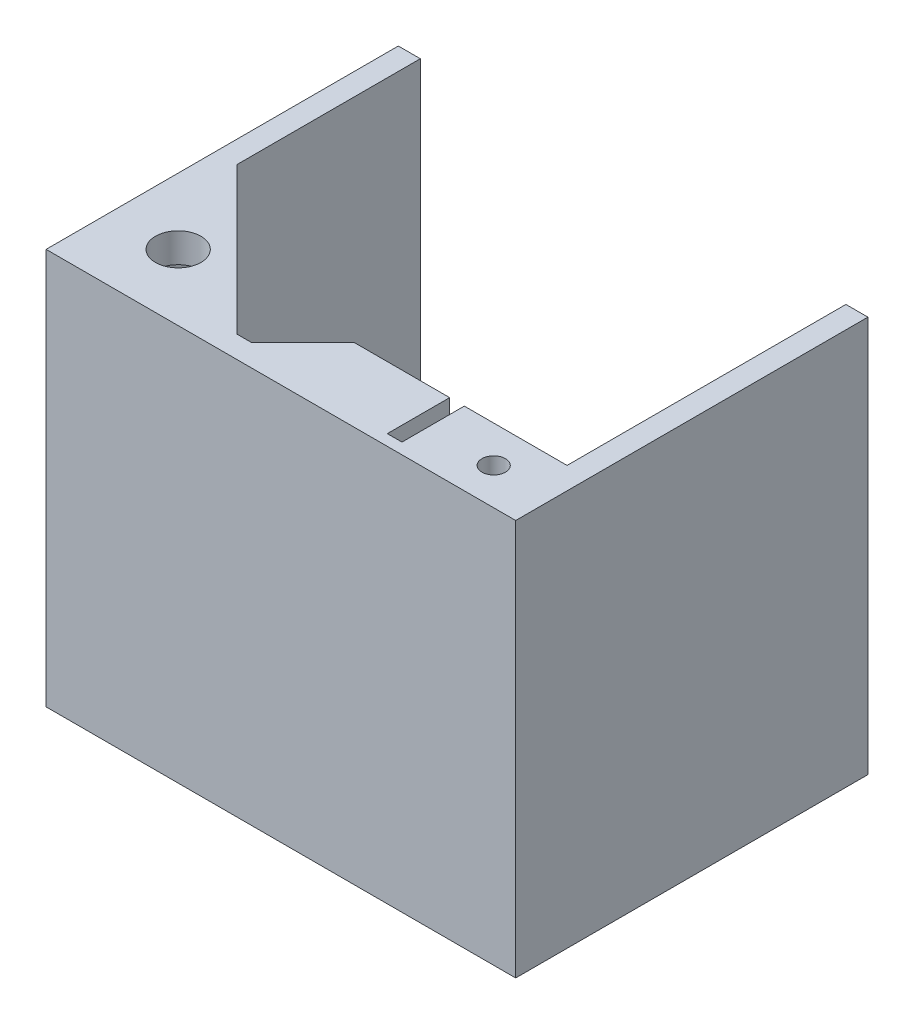
from build123d import *

# Parameters (mm, degrees)
SKETCH1_W           = 64
SKETCH1_H           = 48
BOSS_EXTRUDE1_DEPTH = 4
CUT_EXTRUDE1_DEPTH  = 2.4
CUT_EXTRUDE2_DEPTH  = 2.4
BOSS_EXTRUDE3_DEPTH = 50
BOSS_EXTRUDE4_DEPTH = 50
CUT_EXTRUDE4_DEPTH  = 9.5
SKETCH13_W          = 36.946258726
SKETCH13_H          = 1
CUT_EXTRUDE6_DEPTH  = 32
SKETCH15_R          = 3.1
BOSS_EXTRUDE5_DEPTH = 4
CUT_EXTRUDE7_DEPTH  = 7
SKETCH18_W          = 5.6
SKETCH18_H          = 2.5
CUT_EXTRUDE8_DEPTH  = 5
SKETCH19_W          = 6.595396426
SKETCH19_H          = 7.197552374
SKETCH19_R          = 1.6
BOSS_EXTRUDE8_DEPTH = 4.5
FILLET1_R           = 1.5


with BuildPart() as part:
    # Sketch1 → Boss-Extrude1 (new body)
    with BuildSketch(Plane(origin=(0, 0, 0), x_dir=(1, 0, 0), z_dir=(0, 1, 0))):
        Rectangle(SKETCH1_W, SKETCH1_H)
    extrude(amount=BOSS_EXTRUDE1_DEPTH)

    # Sketch2 → Cut-Extrude1 (cut)
    with BuildSketch(Plane.XZ):
        Polygon((-20.824573519, -16), (-22.41228676, -13.25), (-25.58771324, -13.25), (-27.175426481, -16), (-25.58771324, -18.75), (-22.41228676, -18.75), align=None)
    extrude(amount=-CUT_EXTRUDE1_DEPTH, mode=Mode.SUBTRACT)

    # Sketch4 → Cut-Extrude2 (cut)
    with BuildSketch(Plane.XZ):
        Polygon((9.175426481, 10), (7.58771324, 12.75), (4.41228676, 12.75), (2.824573519, 10), (4.41228676, 7.25), (7.58771324, 7.25), align=None)
    extrude(amount=-CUT_EXTRUDE2_DEPTH, mode=Mode.SUBTRACT)

    # Sketch6 → Boss-Extrude3 (add)
    with BuildSketch(Plane(origin=(0, 4, 0), x_dir=(1, 0, 0), z_dir=(0, 1, 0))):
        Polygon((-29, -21), (-29, 21), (-29, 24), (-32, 24), (-32, -24), (32, -24), (32, 24), (29, 24), (29, 21), (29, -21), align=None)
    extrude(amount=BOSS_EXTRUDE3_DEPTH)

    # Sketch9 → Boss-Extrude4 (add)
    with BuildSketch(Plane(origin=(0, 4, 0), x_dir=(1, 0, 0), z_dir=(0, 1, 0))):
        Polygon((29, -13), (1, -13), (-7, -21), (29, -21), align=None)
    extrude(amount=BOSS_EXTRUDE4_DEPTH)

    # Sketch10 → Cut-Extrude4 (cut)
    with BuildSketch(Plane(origin=(0, 0, 13), x_dir=(-1, 0, 0), z_dir=(0, 0, -1))):
        Polygon((-14.998616503, 39), (-27, 39), (-27, 13), (-1, 13), (-1, 39), (-13.001383497, 39), (-13.001383497, 54), (-14.998616503, 54), align=None)
    extrude(amount=-CUT_EXTRUDE4_DEPTH, mode=Mode.SUBTRACT)

    # Sketch13 → Cut-Extrude6 (cut)
    with BuildSketch(Plane(origin=(0, 54, 0), x_dir=(1, 0, 0), z_dir=(0, 1, 0))):
        with Locations((10.526870637, -13.5)):
            Rectangle(SKETCH13_W, SKETCH13_H)
    extrude(amount=-CUT_EXTRUDE6_DEPTH, mode=Mode.SUBTRACT)

    # Sketch15 → Boss-Extrude5 (add)
    with BuildSketch(Plane(origin=(0, 54, 0), x_dir=(1, 0, 0), z_dir=(0, 1, 0))):
        Polygon((-29, -1), (-9, -21), (-29, -21), align=None)
        with Locations((-23, -15)):
            Circle(SKETCH15_R, mode=Mode.SUBTRACT)
    extrude(amount=-BOSS_EXTRUDE5_DEPTH)

    # Sketch17 → Cut-Extrude7 (cut)
    with BuildSketch(Plane(origin=(0, 54, 0), x_dir=(1, 0, 0), z_dir=(0, 1, 0))):
        Polygon((24, -15.824573519), (21.25, -17.41228676), (21.25, -20.58771324), (24, -22.175426481), (26.75, -20.58771324), (26.75, -17.41228676), align=None)
    extrude(amount=-CUT_EXTRUDE7_DEPTH, mode=Mode.SUBTRACT)

    # Sketch18 → Cut-Extrude8 (cut)
    with BuildSketch(Plane(origin=(0, 0, 14), x_dir=(-1, 0, 0), z_dir=(0, 0, -1))):
        with Locations((-24, 48.25)):
            Rectangle(SKETCH18_W, SKETCH18_H)
    extrude(amount=-CUT_EXTRUDE8_DEPTH, mode=Mode.SUBTRACT)

    # Sketch19 → Boss-Extrude8 (add)
    with BuildSketch(Plane(origin=(0, 54, 0), x_dir=(1, 0, 0), z_dir=(0, 1, 0))):
        with Locations((24, -19)):
            Rectangle(SKETCH19_W, SKETCH19_H)
        with Locations((24, -19)):
            Circle(SKETCH19_R, mode=Mode.SUBTRACT)
    extrude(amount=-BOSS_EXTRUDE8_DEPTH)

    # Fillet1
    fillet1_edges = [part.edges().sort_by_distance(p)[0] for p in [
        (-29, 50, 11),
        (-19, 50, 21),
    ]]
    fillet(fillet1_edges, radius=FILLET1_R)


solid = part.part
